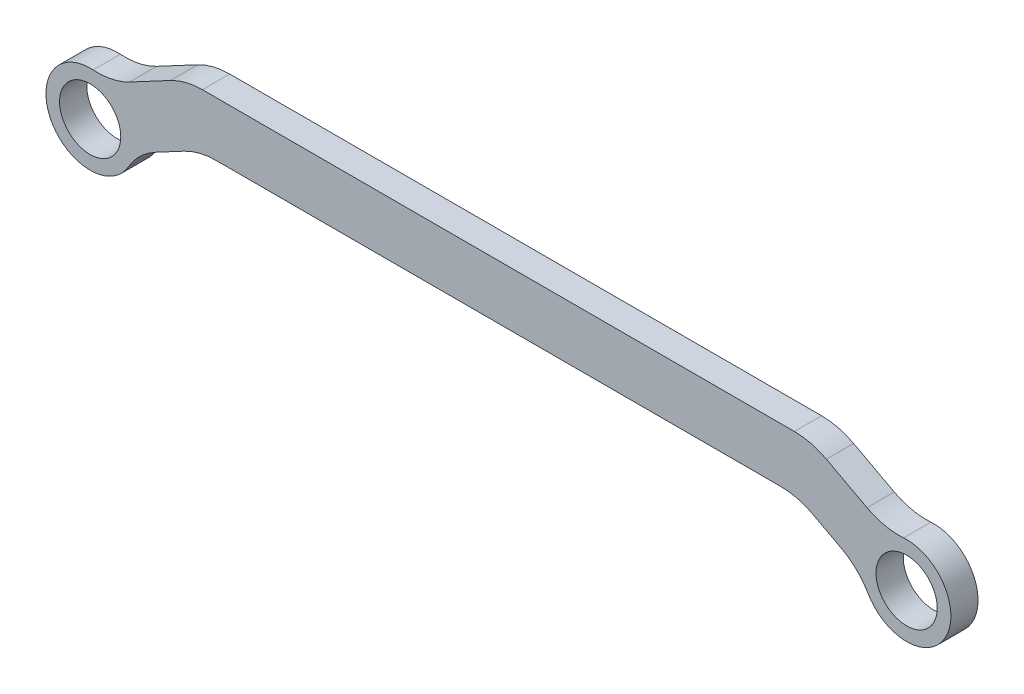
from build123d import *

# Parameters (mm, degrees)
SKETCH1_R           = 4.5
BOSS_EXTRUDE1_DEPTH = 4
FILLET1_R           = 10


with BuildPart() as part:
    # Sketch1 → Boss-Extrude1 (new body)
    with BuildSketch(Plane.XY):
        with BuildLine():
            Line((14, 12), (2.638360632, 5.940459004))
            ThreePointArc((2.638360632, 5.940459004), (-5.735294118, -3.058823529), (6.403066514, -1.118364526))
            Line((6.403066514, -1.118364526), (16, 4))
            Line((16, 4), (104, 4))
            Line((104, 4), (113.596933486, -1.118364526))
            ThreePointArc((113.596933486, -1.118364526), (125.735294118, -3.058823529), (117.361639368, 5.940459004))
            Line((117.361639368, 5.940459004), (106, 12))
            Line((106, 12), (14, 12))
        make_face()
        Circle(SKETCH1_R, mode=Mode.SUBTRACT)
        with Locations((120, 0)):
            Circle(SKETCH1_R, mode=Mode.SUBTRACT)
    extrude(amount=BOSS_EXTRUDE1_DEPTH)

    # Fillet1
    fillet1_edges = [part.edges().sort_by_distance(p)[0] for p in [
        (113.596933486, -1.118364526, 2),
        (117.361639368, 5.940459004, 2),
        (104, 4, 2),
        (106, 12, 2),
        (16, 4, 2),
        (14, 12, 2),
        (6.403066514, -1.118364526, 2),
        (2.638360632, 5.940459004, 2),
    ]]
    fillet(fillet1_edges, radius=FILLET1_R)


solid = part.part
